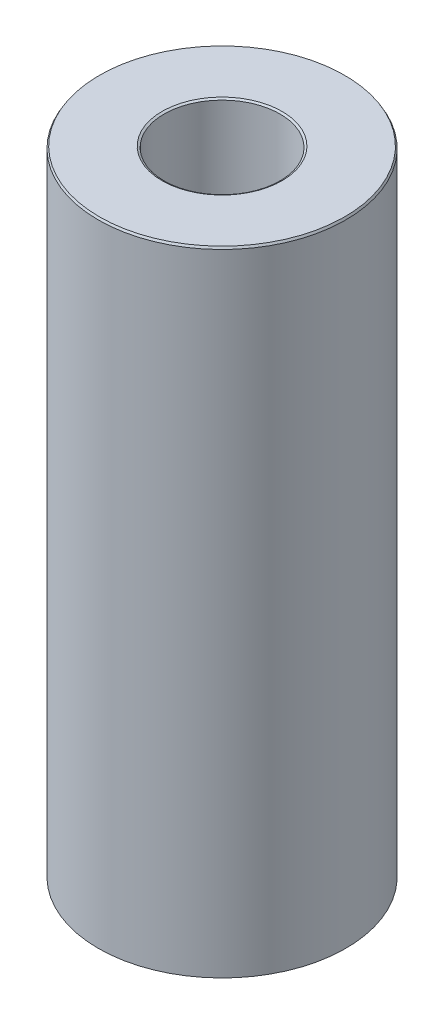
from build123d import *
from OCP.BRepFilletAPI import BRepFilletAPI_MakeChamfer

# Parameters (mm, degrees)
SKETCH1_R           = 57.5
BOSS_EXTRUDE1_DEPTH = 294.504761896
SKETCH2_R           = 26.92515371
CUT_EXTRUDE1_DEPTH  = 306.525047712
CHAMFER1_SIZE       = 0.956667707
CHAMFER1_SIZE2      = 0.552332358


with BuildPart() as part:
    # Sketch1 → Boss-Extrude1 (new body)
    with BuildSketch(Plane(origin=(0, 0, 0), x_dir=(1, 0, 0), z_dir=(0, 1, 0))):
        Circle(SKETCH1_R)
    extrude(amount=BOSS_EXTRUDE1_DEPTH)

    # Sketch2 → Cut-Extrude1 (cut, through all)
    with BuildSketch(Plane(origin=(0, 0, 0), x_dir=(1, 0, 0), z_dir=(0, 1, 0))):
        Circle(SKETCH2_R)
    extrude(amount=CUT_EXTRUDE1_DEPTH, mode=Mode.SUBTRACT)

    # Chamfer1: one chamfer whose edges measure the first distance from different faces: ONE call of the kernel's chamfer builder (chamfer() names one face for all edges)
    chamfer1_edges_1 = [part.edges().sort_by_distance(p)[0] for p in [
        (-26.92515371, 294.504761896, 0),
    ]]
    chamfer1_side_1 = [part.faces().sort_by_distance(p)[0] for p in [
        (-55.873654403, 294.504761896, 0),
    ]]
    chamfer1_edges_2 = [part.edges().sort_by_distance(p)[0] for p in [
        (-26.92515371, 0, 0),
    ]]
    chamfer1_side_2 = [part.faces().sort_by_distance(p)[0] for p in [
        (-26.92515371, 147.252380948, 0),
    ]]
    chamfer1_edges_3 = [part.edges().sort_by_distance(p)[0] for p in [
        (-57.5, 0, 0),
    ]]
    chamfer1_side_3 = [part.faces().sort_by_distance(p)[0] for p in [
        (-55.873654403, 0, 0),
    ]]
    chamfer1_edges_4 = [part.edges().sort_by_distance(p)[0] for p in [
        (-57.5, 294.504761896, 0),
    ]]
    chamfer1_side_4 = [part.faces().sort_by_distance(p)[0] for p in [
        (-57.5, 147.252380948, 0),
    ]]
    chamfer1 = BRepFilletAPI_MakeChamfer(part.part.solid().wrapped)
    for e in chamfer1_edges_1:
        chamfer1.Add(CHAMFER1_SIZE, CHAMFER1_SIZE2, e.wrapped, chamfer1_side_1[0].wrapped)  # the first distance lies on this face
    for e in chamfer1_edges_2:
        chamfer1.Add(CHAMFER1_SIZE, CHAMFER1_SIZE2, e.wrapped, chamfer1_side_2[0].wrapped)  # the first distance lies on this face
    for e in chamfer1_edges_3:
        chamfer1.Add(CHAMFER1_SIZE, CHAMFER1_SIZE2, e.wrapped, chamfer1_side_3[0].wrapped)  # the first distance lies on this face
    for e in chamfer1_edges_4:
        chamfer1.Add(CHAMFER1_SIZE, CHAMFER1_SIZE2, e.wrapped, chamfer1_side_4[0].wrapped)  # the first distance lies on this face
    add(Compound.cast(chamfer1.Shape()), mode=Mode.REPLACE)


solid = part.part
